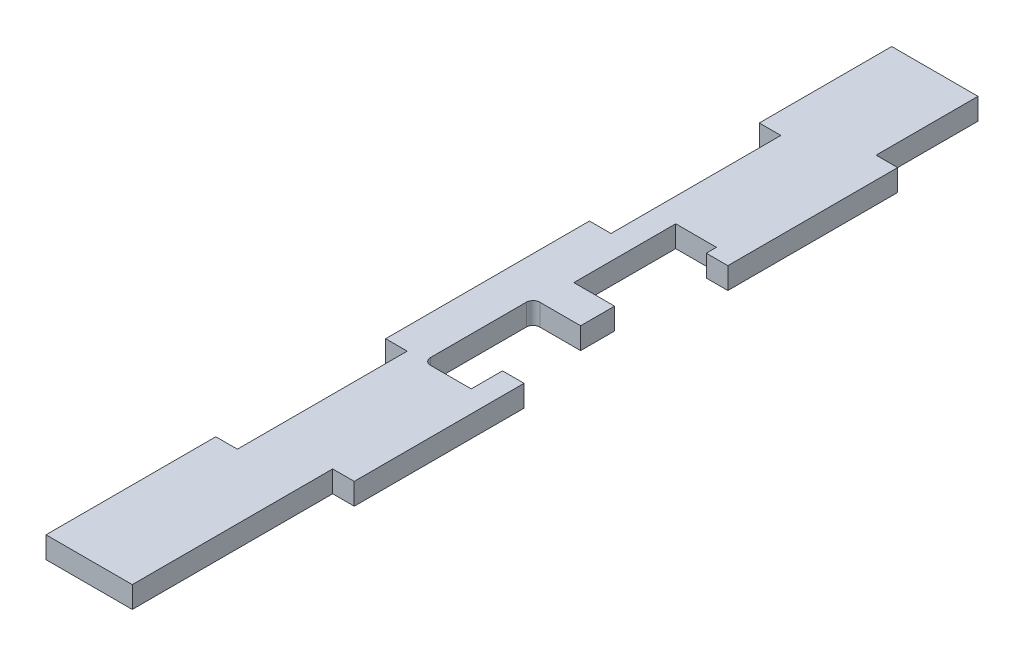
from build123d import *

# Parameters (mm, degrees)
BOSS_EXTRUDE1_DEPTH = 6.35
SKETCH3_W           = 14
SKETCH3_H           = 32.2
SKETCH3_W_2         = 12
SKETCH3_H_2         = 30
CUT_EXTRUDE1_DEPTH  = 252.096365963
FILLET1_R           = 2
SKETCH4_W           = 6.35
SKETCH4_H           = 50
CUT_EXTRUDE2_DEPTH  = 252.096365963


with BuildPart() as part:
    # Sketch2 → Boss-Extrude1 (new body)
    with BuildSketch(Plane(origin=(0, 0, 0), x_dir=(1, 0, 0), z_dir=(0, 1, 0))):
        Polygon((0, 0), (25.4, 0), (25.4, 59), (31.75, 59), (31.75, 109), (25.4, 109), (25.4, 169), (31.75, 169), (31.75, 219), (25.4, 219), (25.4, 249), (0, 249), align=None)
    extrude(amount=BOSS_EXTRUDE1_DEPTH)

    # Sketch3 → Cut-Extrude1 (cut, through all)
    with BuildSketch(Plane(origin=(0, 6.35, 0), x_dir=(1, 0, 0), z_dir=(0, 1, 0))):
        with Locations((18.4, 115.9)):
            Rectangle(SKETCH3_W, SKETCH3_H)
        with Locations((19.4, 157)):
            Rectangle(SKETCH3_W_2, SKETCH3_H_2)
    extrude(amount=-CUT_EXTRUDE1_DEPTH, mode=Mode.SUBTRACT)

    # Fillet1
    fillet1_edges = [part.edges().sort_by_distance(p)[0] for p in [
        (11.4, 3.175, -99.8),
        (11.4, 3.175, -132),
    ]]
    fillet(fillet1_edges, radius=FILLET1_R)

    # Sketch4 → Cut-Extrude2 (cut, through all)
    with BuildSketch(Plane(origin=(0, 6.35, 0), x_dir=(1, 0, 0), z_dir=(0, 1, 0))):
        with Locations((3.175, 75)):
            Rectangle(SKETCH4_W, SKETCH4_H)
        with Locations((3.175, 185)):
            Rectangle(SKETCH4_W, SKETCH4_H)
    extrude(amount=-CUT_EXTRUDE2_DEPTH, mode=Mode.SUBTRACT)


solid = part.part
